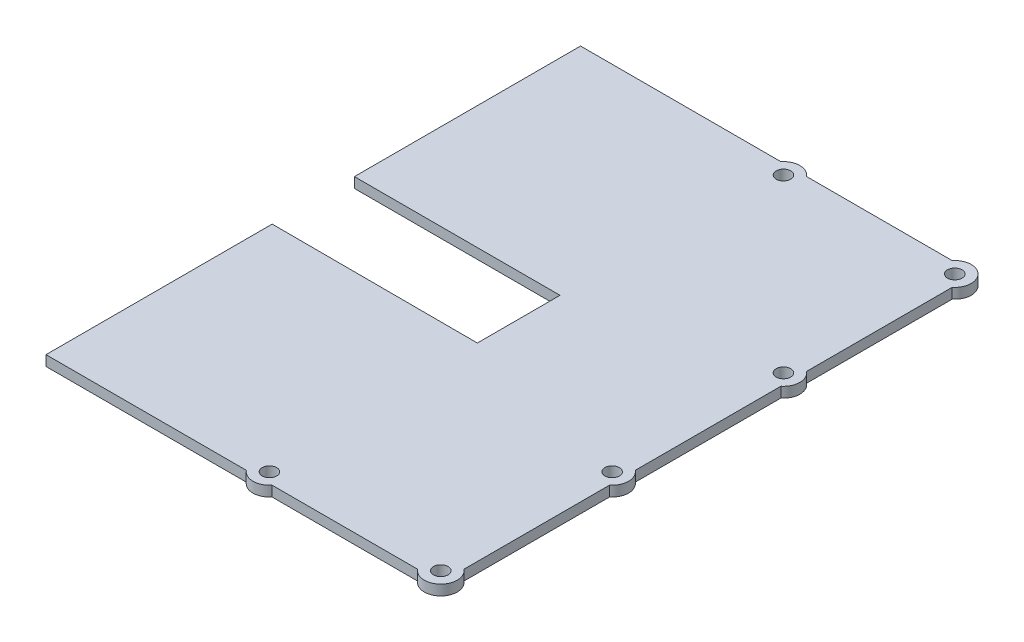
from build123d import *

# Parameters (mm, degrees)
SKETCH1_R           = 2.2479
BOSS_EXTRUDE1_DEPTH = 3.175


with BuildPart() as part:
    # Sketch1 → Boss-Extrude1 (new body)
    with BuildSketch(Plane(origin=(0, 0, 0), x_dir=(1, 0, 0), z_dir=(0, 1, 0))):
        with BuildLine():
            Line((0, 165.1), (61.874509804, 165.1))
            ThreePointArc((61.874509804, 165.1), (65.840083533, 167.005), (69.805657262, 165.1))
            Line((69.805657262, 165.1), (114.791176471, 165.1))
            ThreePointArc((114.791176471, 165.1), (122.348852648, 165.517102448), (121.9317502, 157.959426271))
            Line((121.9317502, 157.959426271), (121.9317502, 112.973907062))
            ThreePointArc((121.9317502, 112.973907062), (123.8367502, 109.008333333), (121.9317502, 105.042759604))
            Line((121.9317502, 105.042759604), (121.9317502, 60.057240396))
            ThreePointArc((121.9317502, 60.057240396), (123.8367502, 56.091666667), (121.9317502, 52.126092938))
            Line((121.9317502, 52.126092938), (121.9317502, 7.140573729))
            ThreePointArc((121.9317502, 7.140573729), (122.348852648, -0.417102448), (114.791176471, 0))
            Line((114.791176471, 0), (69.805657262, 0))
            ThreePointArc((69.805657262, 0), (65.840083533, -1.905), (61.874509804, 0))
            Line((61.874509804, 0), (0, 0))
            Line((0, 0), (0, 69.85))
            Line((0, 69.85), (63.5, 69.72449217))
            Line((63.5, 69.72449217), (63.5, 95.25))
            Line((63.5, 95.25), (0, 95.25))
            Line((0, 95.25), (0, 165.1))
        make_face()
        with Locations((65.840083533, 3.175)):
            Circle(SKETCH1_R, mode=Mode.SUBTRACT)
        with Locations((118.7567502, 3.175)):
            Circle(SKETCH1_R, mode=Mode.SUBTRACT)
        with Locations((118.7567502, 56.091666667)):
            Circle(SKETCH1_R, mode=Mode.SUBTRACT)
        with Locations((118.7567502, 109.008333333)):
            Circle(SKETCH1_R, mode=Mode.SUBTRACT)
        with Locations((118.7567502, 161.925)):
            Circle(SKETCH1_R, mode=Mode.SUBTRACT)
        with Locations((65.840083533, 161.925)):
            Circle(SKETCH1_R, mode=Mode.SUBTRACT)
    extrude(amount=BOSS_EXTRUDE1_DEPTH)


solid = part.part
